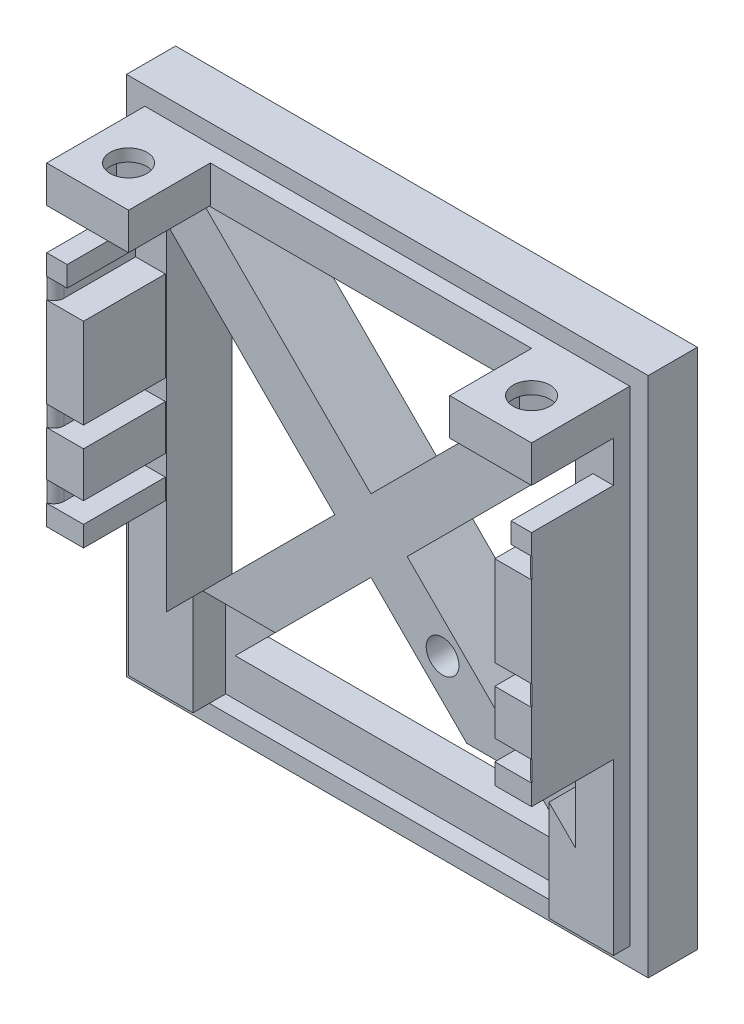
from build123d import *

# Parameters (mm, degrees)
ESBO_O3_W                = 47.4
ESBO_O3_H                = 47.4
RESSALTO_EXTRUS_O2_DEPTH = 1.6
ESBO_O5_W                = 51
ESBO_O5_H                = 51
RESSALTO_EXTRUS_O3_DEPTH = 1.6
CORTE_EXTRUS_O1_DEPTH    = 3.2
ESBO_O7_W                = 8
ESBO_O7_H                = 3.6
RESSALTO_EXTRUS_O4_DEPTH = 8
FILETE1_R                = 1
ESBO_O8_W                = 51
ESBO_O8_H                = 51
RESSALTO_EXTRUS_O5_DEPTH = 3.2
ESBO_O9_W                = 34.8
ESBO_O9_H                = 10.8
CORTE_EXTRUS_O2_DEPTH    = 3.2
ESBO_O10_R               = 1.6
CORTE_EXTRUS_O3_DEPTH    = 37.939139135
ESBO_O11_R               = 1.8
CORTE_EXTRUS_O4_DEPTH    = 2.4
ESBO_O11_2_R             = 1.8
CORTE_EXTRUS_O5_DEPTH    = 54.120335089


with BuildPart() as part:
    # Esboço3 → Ressalto-extrusão2 (new body)
    with BuildSketch(Plane.XY):
        Rectangle(ESBO_O3_W, ESBO_O3_H)
    extrude(amount=RESSALTO_EXTRUS_O2_DEPTH)

    # Esboço5 → Ressalto-extrusão3 (add)
    with BuildSketch(Plane(origin=(0, 0, 0), x_dir=(-1, 0, 0), z_dir=(0, 0, -1))):
        Rectangle(ESBO_O5_W, ESBO_O5_H)
    extrude(amount=RESSALTO_EXTRUS_O3_DEPTH)

    # Esboço6 → Corte-extrusão1 (cut)
    with BuildSketch(Plane(origin=(0, 0, -1.6), x_dir=(-1, 0, 0), z_dir=(0, 0, -1))):
        Polygon((3.535533906, 0), (20, 16.464466094), (20, -16.464466094), align=None)
        Polygon((-16.464466094, -20), (0, -3.535533906), (16.464466094, -20), align=None)
        Polygon((-20, 16.464466094), (-3.535533906, 0), (-20, -16.464466094), align=None)
        Polygon((-16.464466094, 20), (0, 3.535533906), (16.464466094, 20), align=None)
    extrude(amount=-CORTE_EXTRUS_O1_DEPTH, mode=Mode.SUBTRACT)

    # Esboço7 → Ressalto-extrusão4 (add)
    with BuildSketch(Plane.XY.offset(1.6)):
        Polygon((-23.7, 16.1), (-23.7, -7.1), (-20.1, -7.1), (-20.1, -5.1), (-23, -5.1), (-23, -3.1), (-20.1, -3.1), (-20.1, 1.3), (-23, 1.3), (-23, 3.3), (-20.1, 3.3), (-20.1, 12.1), (-23, 12.1), (-23, 14.1), (-21.7, 14.1), (-21.7, 16.1), align=None)
        with Locations((-19.7, 21.9)):
            Rectangle(ESBO_O7_W, ESBO_O7_H)
    ressalto_extrus_o4 = extrude(amount=RESSALTO_EXTRUS_O4_DEPTH)

    # Espelhar1: Ressalto-extrusão4 across plane
    add(ressalto_extrus_o4.mirror(Plane(origin=(0, 0, 0), x_dir=(0, 0, 1), z_dir=(1, 0, 0))))

    # Filete1
    # the kernel refuses this fillet: 1 mm, written as the material it takes off along each edge
    with BuildSketch(Plane(origin=(-23, 1.3, 9.6), x_dir=(-1, 0, 0), z_dir=(0, 1, 0)), Plane(origin=(-23, 12.1, 9.6), x_dir=(-1, 0, 0), z_dir=(0, 1, 0)), Plane(origin=(-23, -5.1, 9.6), x_dir=(-1, 0, 0), z_dir=(0, 1, 0))) as filete1_piece_1:
        with BuildLine():
            CenterArc((FILETE1_R, -FILETE1_R), FILETE1_R, 90, 90)
            Line((0, -FILETE1_R), (0, 0))
            Line((0, 0), (FILETE1_R, 0))
        make_face()
    extrude(amount=2, mode=Mode.SUBTRACT)
    with BuildSketch(Plane(origin=(23, 12.1, 9.6), x_dir=(1, 0, 0), z_dir=(0, 1, 0)), Plane(origin=(23, 1.3, 9.6), x_dir=(1, 0, 0), z_dir=(0, 1, 0)), Plane(origin=(23, -5.1, 9.6), x_dir=(1, 0, 0), z_dir=(0, 1, 0))) as filete1_piece_2:
        with BuildLine():
            CenterArc((FILETE1_R, FILETE1_R), FILETE1_R, 180, 90)
            Line((0, FILETE1_R), (0, 0))
            Line((0, 0), (FILETE1_R, 0))
        make_face()
    extrude(amount=2, mode=Mode.SUBTRACT)

    # Esboço8 → Ressalto-extrusão5 (add)
    with BuildSketch(Plane(origin=(0, 0, -1.6), x_dir=(-1, 0, 0), z_dir=(0, 0, -1))):
        Rectangle(ESBO_O8_W, ESBO_O8_H)
        Polygon((-16.464466094, -20), (16.464466094, -20), (0, -3.535533906), align=None, mode=Mode.SUBTRACT)
        Polygon((-20, -16.464466094), (-3.535533906, 0), (-20, 16.464466094), align=None, mode=Mode.SUBTRACT)
        Polygon((3.535533906, 0), (20, -16.464466094), (20, 16.464466094), align=None, mode=Mode.SUBTRACT)
        Polygon((0, 3.535533906), (16.464466094, 20), (-16.464466094, 20), align=None, mode=Mode.SUBTRACT)
    extrude(amount=RESSALTO_EXTRUS_O5_DEPTH)

    # Esboço9 → Corte-extrusão2 (cut)
    with BuildSketch(Plane.XY.offset(1.6)):
        with Locations((0, -18.3)):
            Rectangle(ESBO_O9_W, ESBO_O9_H)
    extrude(amount=-CORTE_EXTRUS_O2_DEPTH, mode=Mode.SUBTRACT)

    # Esboço10 → Corte-extrusão3 (cut, through all)
    with BuildSketch(Plane.XY.offset(1.6)):
        with Locations((7, -6.7)):
            Circle(ESBO_O10_R)
    extrude(amount=-CORTE_EXTRUS_O3_DEPTH, mode=Mode.SUBTRACT)

    # Esboço11 → Corte-extrusão4 (cut)
    with BuildSketch(Plane.XZ.offset(-20.1)):
        Polygon((-19.7, 8.833161507), (-22.5, 7.216580754), (-22.5, 3.983419246), (-19.7, 2.366838493), (-16.9, 3.983419246), (-16.9, 7.216580754), align=None)
        with Locations(Location((-19.7, 5.6, 0), (0, 0, 270))):
            Circle(ESBO_O11_R, mode=Mode.SUBTRACT)
    corte_extrus_o4 = extrude(amount=-CORTE_EXTRUS_O4_DEPTH, mode=Mode.SUBTRACT)

    # Esboço11<2> → Corte-extrusão5 (cut, through all)
    with BuildSketch(Plane.XZ.offset(-20.1)):
        with Locations(Location((-19.7, 5.6, 0), (0, 0, 270))):
            Circle(ESBO_O11_2_R)
    corte_extrus_o5 = extrude(amount=-CORTE_EXTRUS_O5_DEPTH, mode=Mode.SUBTRACT)

    # Espelhar2: Corte-extrusão4, Corte-extrusão5 across plane
    add(corte_extrus_o4.mirror(Plane(origin=(0, 0, 0), x_dir=(0, 0, 1), z_dir=(1, 0, 0))), mode=Mode.SUBTRACT)
    add(corte_extrus_o5.mirror(Plane(origin=(0, 0, 0), x_dir=(0, 0, 1), z_dir=(1, 0, 0))), mode=Mode.SUBTRACT)


solid = part.part
